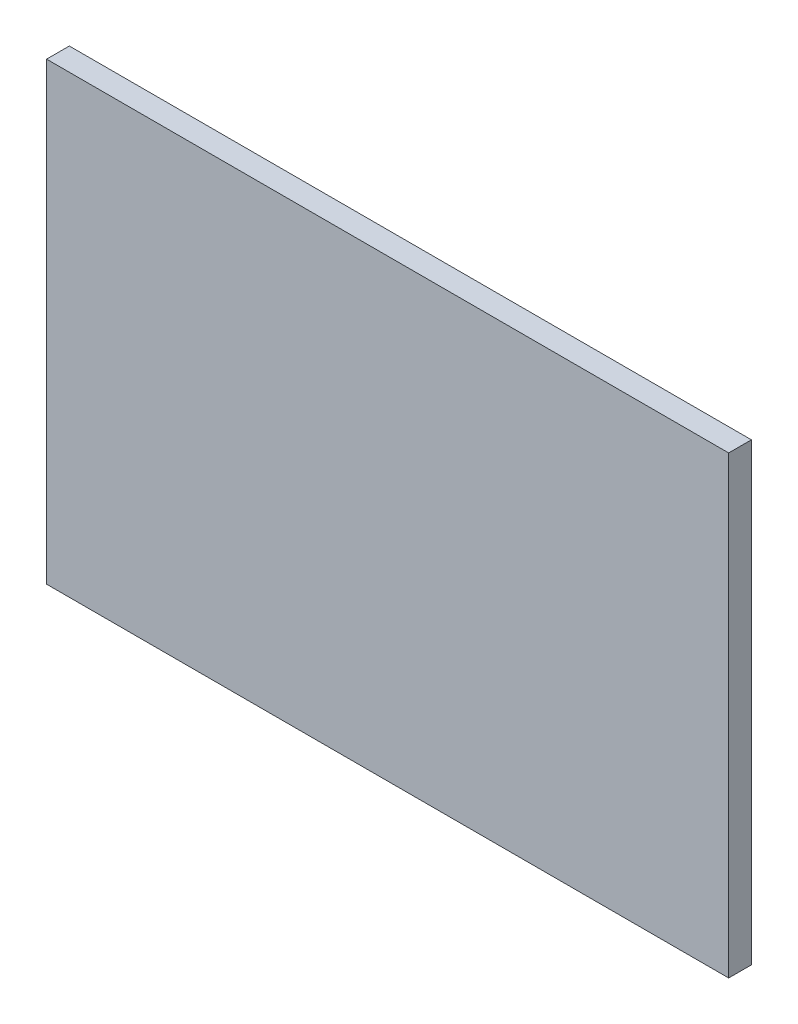
from build123d import *

# Parameters (mm, degrees)
CROQUIS1_W              = 300
CROQUIS1_H              = 200
SALIENTE_EXTRUIR1_DEPTH = 10


with BuildPart() as part:
    # Croquis1 → Saliente-Extruir1 (new body)
    with BuildSketch(Plane.XY):
        with Locations((-144.934554974, -91.263089005)):
            Rectangle(CROQUIS1_W, CROQUIS1_H)
    extrude(amount=SALIENTE_EXTRUIR1_DEPTH)


solid = part.part
